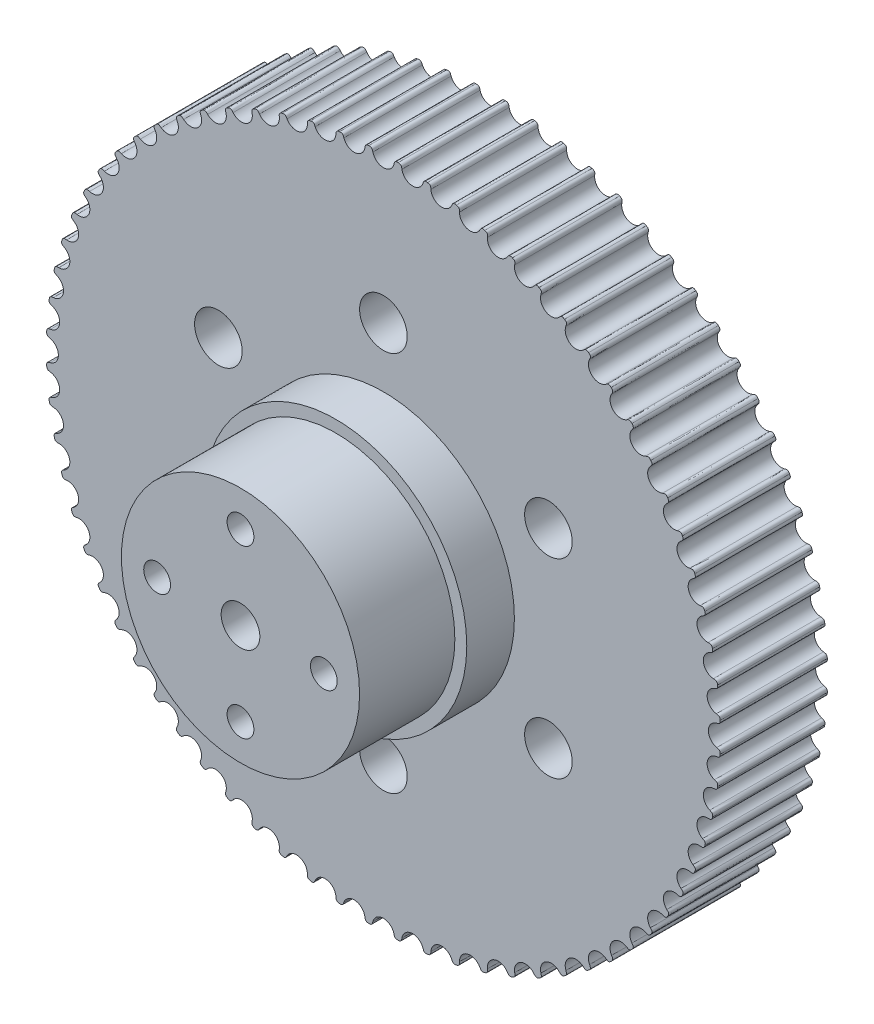
from build123d import *

# Parameters (mm, degrees)
EXTRUDE_2_DEPTH      = 18
SKETCH_23_R          = 22
EXTRUDE_5_DEPTH      = 8
SKETCH_24_R          = 20
EXTRUDE_6_DEPTH      = 16
SKETCH_25_R          = 3.25
SKETCH_25_R_2        = 2.25
CUT_EXTRUDE_16_DEPTH = 91.3315679
SKETCH_26_R          = 2.25
CUT_EXTRUDE_17_DEPTH = 91.3315679
SKETCH_27_R          = 4
CUT_EXTRUDE_18_DEPTH = 6
CUT_EXTRUDE_19_DEPTH = 12


# Read off the part's stored shape, not the designer's step: Бобышка-Вытянуть2
with BuildPart() as part:
    # Бобышка-Вытянуть2 outline → Бобышка-Вытянуть2 (new body)
    with BuildSketch(Plane.XY):
        with BuildLine():
            add(Edge.make_bspline(
                [(2.468857325, 56.546129342), (2.17643088, 56.560299637), (2.101180795, 56.529371891), (1.843370743, 56.341695548), (1.831638936, 56.156220412), (1.765942991, 55.959721279)],
                knots=[0, 0, 0, 0, 0.423843508, 0.523843508, 1, 1, 1, 1], degree=3))
            ThreePointArc((1.765942991, 55.959721279), (0, 54.58), (-1.765942991, 55.959721279))
            add(Edge.make_bspline(
                [(-2.468857325, 56.546129342), (-2.17643088, 56.560299637), (-2.101180795, 56.529371891), (-1.843370743, 56.341695548), (-1.831638936, 56.156220412), (-1.765942991, 55.959721279)],
                knots=[0, 0, 0, 0, 0.423843508, 0.523843508, 1, 1, 1, 1], degree=3))
            add(Edge.make_bspline(
                [(-2.468857325, 56.546129342), (-2.761406021, 56.534759071), (-2.833674226, 56.497390537), (-3.074146162, 56.287958732), (-3.069668103, 56.102166891), (-3.117988027, 55.900689718)],
                knots=[0, 0, 0, 0, 0.423843508, 0.523843508, 1, 1, 1, 1], degree=3))
            ThreePointArc((-3.117988027, 55.900689718), (-4.756960439, 54.372306622), (-6.636434117, 55.592865572))
            add(Edge.make_bspline(
                [(-7.38778248, 56.115779154), (-7.097703829, 56.155382171), (-7.020044562, 56.131130591), (-6.746858484, 55.96663804), (-6.719006097, 55.782891187), (-6.636434117, 55.592865572)],
                knots=[0, 0, 0, 0, 0.423843508, 0.523843508, 1, 1, 1, 1], degree=3))
            add(Edge.make_bspline(
                [(-7.38778248, 56.115779154), (-7.678226956, 56.078954852), (-7.746963276, 56.035429927), (-7.968266959, 55.805836563), (-7.947613114, 55.621142005), (-7.978189274, 55.416220155)],
                knots=[0, 0, 0, 0, 0.423843508, 0.523843508, 1, 1, 1, 1], degree=3))
            ThreePointArc((-7.978189274, 55.416220155), (-9.477717537, 53.750807159), (-11.456417972, 54.80291459))
            add(Edge.make_bspline(
                [(-12.250482149, 55.258354003), (-11.964958965, 55.323088339), (-11.885481551, 55.305697495), (-11.598998558, 55.165640623), (-11.555237564, 54.985020478), (-11.456417972, 54.80291459)],
                knots=[0, 0, 0, 0, 0.423843508, 0.523843508, 1, 1, 1, 1], degree=3))
            add(Edge.make_bspline(
                [(-12.250482149, 55.258354003), (-12.536611946, 55.196355925), (-12.601293257, 55.14700586), (-12.801744433, 54.898998282), (-12.765071991, 54.716806643), (-12.777671683, 54.509999694)],
                knots=[0, 0, 0, 0, 0.423843508, 0.523843508, 1, 1, 1, 1], degree=3))
            ThreePointArc((-12.777671683, 54.509999694), (-14.126343482, 52.720231599), (-16.189211569, 53.595880337))
            add(Edge.make_bspline(
                [(-17.019948252, 53.980379412), (-16.741153539, 54.0697524), (-16.660462849, 54.059354646), (-16.362863249, 53.944799371), (-16.303526697, 53.768680562), (-16.189211569, 53.595880337)],
                knots=[0, 0, 0, 0, 0.423843508, 0.523843508, 1, 1, 1, 1], degree=3))
            add(Edge.make_bspline(
                [(-17.019948252, 53.980379412), (-17.299585751, 53.8936794), (-17.359719788, 53.83887978), (-17.537792902, 53.574345474), (-17.485380962, 53.396043344), (-17.479908295, 53.188925222)],
                knots=[0, 0, 0, 0, 0.423843508, 0.523843508, 1, 1, 1, 1], degree=3))
            ThreePointArc((-17.479908295, 53.188925222), (-18.667459423, 51.288423242), (-20.79879549, 51.980949073))
            add(Edge.make_bspline(
                [(-21.659882272, 52.29158154), (-21.389937826, 52.404912997), (-21.308647964, 52.401587467), (-21.002196671, 52.313405623), (-20.927736146, 52.143128521), (-20.79879549, 51.980949073)],
                knots=[0, 0, 0, 0, 0.423843508, 0.523843508, 1, 1, 1, 1], degree=3))
            add(Edge.make_bspline(
                [(-21.659882272, 52.29158154), (-21.930899262, 52.180839434), (-21.986028369, 52.121007316), (-22.140368177, 51.841959549), (-22.072615626, 51.668903913), (-22.04911225, 51.463050913)],
                knots=[0, 0, 0, 0, 0.423843508, 0.523843508, 1, 1, 1, 1], degree=3))
            ThreePointArc((-22.04911225, 51.463050913), (-23.066504726, 49.466279016), (-25.250088019, 49.970411399))
            add(Edge.make_bspline(
                [(-26.134971509, 50.204813158), (-25.875931771, 50.341240563), (-25.794661402, 50.345012566), (-25.481690695, 50.28387527), (-25.392672887, 50.120735787), (-25.250088019, 49.970411399)],
                knots=[0, 0, 0, 0, 0.423843508, 0.523843508, 1, 1, 1, 1], degree=3))
            add(Edge.make_bspline(
                [(-26.134971509, 50.204813158), (-26.395305387, 50.070871772), (-26.445009999, 50.006462515), (-26.574441882, 49.715025008), (-26.491864357, 49.548532925), (-26.450509148, 49.345511712)],
                knots=[0, 0, 0, 0, 0.423843508, 0.523843508, 1, 1, 1, 1], degree=3))
            ThreePointArc((-26.450509148, 49.345511712), (-27.290000001, 47.267666539), (-29.509212132, 47.579568721))
            add(Edge.make_bspline(
                [(-30.411157832, 47.735955833), (-30.164994251, 47.894440891), (-30.084361892, 47.90528172), (-29.767253666, 47.871654265), (-29.664356055, 47.716893989), (-29.509212132, 47.579568721)],
                knots=[0, 0, 0, 0, 0.423843508, 0.523843508, 1, 1, 1, 1], degree=3))
            add(Edge.make_bspline(
                [(-30.411157832, 47.735955833), (-30.6588273, 47.579834542), (-30.702729135, 47.51133834), (-30.806268038, 47.209729108), (-30.709494004, 47.051067684), (-30.650601699, 46.852423372)],
                knots=[0, 0, 0, 0, 0.423843508, 0.523843508, 1, 1, 1, 1], degree=3))
            ThreePointArc((-30.650601699, 46.852423372), (-31.305801896, 44.709318577), (-33.543753322, 44.826616796))
            add(Edge.make_bspline(
                [(-34.455896882, 44.90379906), (-34.22448291, 45.083135605), (-34.145102222, 45.100962754), (-33.826269863, 45.095101065), (-33.710275562, 44.949897816), (-33.543753322, 44.826616796)],
                knots=[0, 0, 0, 0, 0.423843508, 0.523843508, 1, 1, 1, 1], degree=3))
            add(Edge.make_bspline(
                [(-34.455896882, 44.90379906), (-34.689017025, 44.726686041), (-34.726781963, 44.654624191), (-34.803639892, 44.345138664), (-34.693405859, 44.195515407), (-34.617424665, 44.002759799)],
                knots=[0, 0, 0, 0, 0.423843508, 0.523843508, 1, 1, 1, 1], degree=3))
            ThreePointArc((-34.617424665, 44.002759799), (-35.083347736, 41.810705705), (-37.323006295, 41.73250725))
            add(Edge.make_bspline(
                [(-38.238405751, 41.729897263), (-38.023502589, 41.928720435), (-37.945977707, 41.953398229), (-37.627847721, 41.975346916), (-37.499639517, 41.84080578), (-37.323006295, 41.73250725)],
                knots=[0, 0, 0, 0, 0.423843508, 0.523843508, 1, 1, 1, 1], degree=3))
            add(Edge.make_bspline(
                [(-38.238405751, 41.729897263), (-38.455202385, 41.533140454), (-38.486543012, 41.458061389), (-38.536135033, 41.143054938), (-38.413279947, 41.003608572), (-38.320788126, 40.818208654)],
                knots=[0, 0, 0, 0, 0.423843508, 0.523843508, 1, 1, 1, 1], degree=3))
            ThreePointArc((-38.320788126, 40.818208654), (-38.593888117, 38.593888117), (-40.818208654, 38.320788126))
            add(Edge.make_bspline(
                [(-41.729897263, 38.238405751), (-41.533140454, 38.455202385), (-41.458061389, 38.486543012), (-41.143054938, 38.536135033), (-41.003608572, 38.413279947), (-40.818208654, 38.320788126)],
                knots=[0, 0, 0, 0, 0.423843508, 0.523843508, 1, 1, 1, 1], degree=3))
            add(Edge.make_bspline(
                [(-41.729897263, 38.238405751), (-41.928720435, 38.023502589), (-41.953398229, 37.945977707), (-41.975346916, 37.627847721), (-41.84080578, 37.499639517), (-41.73250725, 37.323006295)],
                knots=[0, 0, 0, 0, 0.423843508, 0.523843508, 1, 1, 1, 1], degree=3))
            ThreePointArc((-41.73250725, 37.323006295), (-41.810705705, 35.083347736), (-44.002759799, 34.617424665))
            add(Edge.make_bspline(
                [(-44.90379906, 34.455896882), (-44.726686041, 34.689017025), (-44.654624191, 34.726781963), (-44.345138664, 34.803639892), (-44.195515407, 34.693405859), (-44.002759799, 34.617424665)],
                knots=[0, 0, 0, 0, 0.423843508, 0.523843508, 1, 1, 1, 1], degree=3))
            add(Edge.make_bspline(
                [(-44.90379906, 34.455896882), (-45.083135605, 34.22448291), (-45.100962754, 34.145102222), (-45.095101065, 33.826269863), (-44.949897816, 33.710275562), (-44.826616796, 33.543753322)],
                knots=[0, 0, 0, 0, 0.423843508, 0.523843508, 1, 1, 1, 1], degree=3))
            ThreePointArc((-44.826616796, 33.543753322), (-44.709318577, 31.305801896), (-46.852423372, 30.650601699))
            add(Edge.make_bspline(
                [(-47.735955833, 30.411157832), (-47.579834542, 30.6588273), (-47.51133834, 30.702729135), (-47.209729108, 30.806268038), (-47.051067684, 30.709494004), (-46.852423372, 30.650601699)],
                knots=[0, 0, 0, 0, 0.423843508, 0.523843508, 1, 1, 1, 1], degree=3))
            add(Edge.make_bspline(
                [(-47.735955833, 30.411157832), (-47.894440891, 30.164994251), (-47.90528172, 30.084361892), (-47.871654265, 29.767253666), (-47.716893989, 29.664356055), (-47.579568721, 29.509212132)],
                knots=[0, 0, 0, 0, 0.423843508, 0.523843508, 1, 1, 1, 1], degree=3))
            ThreePointArc((-47.579568721, 29.509212132), (-47.267666539, 27.290000001), (-49.345511712, 26.450509148))
            add(Edge.make_bspline(
                [(-50.204813158, 26.134971509), (-50.070871772, 26.395305387), (-50.006462515, 26.445009999), (-49.715025008, 26.574441882), (-49.548532925, 26.491864357), (-49.345511712, 26.450509148)],
                knots=[0, 0, 0, 0, 0.423843508, 0.523843508, 1, 1, 1, 1], degree=3))
            add(Edge.make_bspline(
                [(-50.204813158, 26.134971509), (-50.341240563, 25.875931771), (-50.345012566, 25.794661402), (-50.28387527, 25.481690695), (-50.120735787, 25.392672887), (-49.970411399, 25.250088019)],
                knots=[0, 0, 0, 0, 0.423843508, 0.523843508, 1, 1, 1, 1], degree=3))
            ThreePointArc((-49.970411399, 25.250088019), (-49.466279016, 23.066504726), (-51.463050913, 22.04911225))
            add(Edge.make_bspline(
                [(-52.29158154, 21.659882272), (-52.180839434, 21.930899262), (-52.121007316, 21.986028369), (-51.841959549, 22.140368177), (-51.668903913, 22.072615626), (-51.463050913, 22.04911225)],
                knots=[0, 0, 0, 0, 0.423843508, 0.523843508, 1, 1, 1, 1], degree=3))
            add(Edge.make_bspline(
                [(-52.29158154, 21.659882272), (-52.404912997, 21.389937826), (-52.401587467, 21.308647964), (-52.313405623, 21.002196671), (-52.143128521, 20.927736146), (-51.980949073, 20.79879549)],
                knots=[0, 0, 0, 0, 0.423843508, 0.523843508, 1, 1, 1, 1], degree=3))
            ThreePointArc((-51.980949073, 20.79879549), (-51.288423242, 18.667459423), (-53.188925222, 17.479908295))
            add(Edge.make_bspline(
                [(-53.980379412, 17.019948252), (-53.8936794, 17.299585751), (-53.83887978, 17.359719788), (-53.574345474, 17.537792902), (-53.396043344, 17.485380962), (-53.188925222, 17.479908295)],
                knots=[0, 0, 0, 0, 0.423843508, 0.523843508, 1, 1, 1, 1], degree=3))
            add(Edge.make_bspline(
                [(-53.980379412, 17.019948252), (-54.0697524, 16.741153539), (-54.059354646, 16.660462849), (-53.944799371, 16.362863249), (-53.768680562, 16.303526697), (-53.595880337, 16.189211569)],
                knots=[0, 0, 0, 0, 0.423843508, 0.523843508, 1, 1, 1, 1], degree=3))
            ThreePointArc((-53.595880337, 16.189211569), (-52.720231599, 14.126343482), (-54.509999694, 12.777671683))
            add(Edge.make_bspline(
                [(-55.258354003, 12.250482149), (-55.196355925, 12.536611946), (-55.14700586, 12.601293257), (-54.898998282, 12.801744433), (-54.716806643, 12.765071991), (-54.509999694, 12.777671683)],
                knots=[0, 0, 0, 0, 0.423843508, 0.523843508, 1, 1, 1, 1], degree=3))
            add(Edge.make_bspline(
                [(-55.258354003, 12.250482149), (-55.323088339, 11.964958965), (-55.305697495, 11.885481551), (-55.165640623, 11.598998558), (-54.985020478, 11.555237564), (-54.80291459, 11.456417972)],
                knots=[0, 0, 0, 0, 0.423843508, 0.523843508, 1, 1, 1, 1], degree=3))
            ThreePointArc((-54.80291459, 11.456417972), (-53.750807159, 9.477717537), (-55.416220155, 7.978189274))
            add(Edge.make_bspline(
                [(-56.115779154, 7.38778248), (-56.078954852, 7.678226956), (-56.035429927, 7.746963276), (-55.805836563, 7.968266959), (-55.621142005, 7.947613114), (-55.416220155, 7.978189274)],
                knots=[0, 0, 0, 0, 0.423843508, 0.523843508, 1, 1, 1, 1], degree=3))
            add(Edge.make_bspline(
                [(-56.115779154, 7.38778248), (-56.155382171, 7.097703829), (-56.131130591, 7.020044562), (-55.96663804, 6.746858484), (-55.782891187, 6.719006097), (-55.592865572, 6.636434117)],
                knots=[0, 0, 0, 0, 0.423843508, 0.523843508, 1, 1, 1, 1], degree=3))
            ThreePointArc((-55.592865572, 6.636434117), (-54.372306622, 4.756960439), (-55.900689718, 3.117988027))
            add(Edge.make_bspline(
                [(-56.546129342, 2.468857325), (-56.534759071, 2.761406021), (-56.497390537, 2.833674226), (-56.287958732, 3.074146162), (-56.102166891, 3.069668103), (-55.900689718, 3.117988027)],
                knots=[0, 0, 0, 0, 0.423843508, 0.523843508, 1, 1, 1, 1], degree=3))
            add(Edge.make_bspline(
                [(-56.546129342, 2.468857325), (-56.560299637, 2.17643088), (-56.529371891, 2.101180795), (-56.341695548, 1.843370743), (-56.156220412, 1.831638936), (-55.959721279, 1.765942991)],
                knots=[0, 0, 0, 0, 0.423843508, 0.523843508, 1, 1, 1, 1], degree=3))
            ThreePointArc((-55.959721279, 1.765942991), (-54.58, 0), (-55.959721279, -1.765942991))
            add(Edge.make_bspline(
                [(-56.546129342, -2.468857325), (-56.560299637, -2.17643088), (-56.529371891, -2.101180795), (-56.341695548, -1.843370743), (-56.156220412, -1.831638936), (-55.959721279, -1.765942991)],
                knots=[0, 0, 0, 0, 0.423843508, 0.523843508, 1, 1, 1, 1], degree=3))
            add(Edge.make_bspline(
                [(-56.546129342, -2.468857325), (-56.534759071, -2.761406021), (-56.497390537, -2.833674226), (-56.287958732, -3.074146162), (-56.102166891, -3.069668103), (-55.900689718, -3.117988027)],
                knots=[0, 0, 0, 0, 0.423843508, 0.523843508, 1, 1, 1, 1], degree=3))
            ThreePointArc((-55.900689718, -3.117988027), (-54.372306622, -4.756960439), (-55.592865572, -6.636434117))
            add(Edge.make_bspline(
                [(-56.115779154, -7.38778248), (-56.155382171, -7.097703829), (-56.131130591, -7.020044562), (-55.96663804, -6.746858484), (-55.782891187, -6.719006097), (-55.592865572, -6.636434117)],
                knots=[0, 0, 0, 0, 0.423843508, 0.523843508, 1, 1, 1, 1], degree=3))
            add(Edge.make_bspline(
                [(-56.115779154, -7.38778248), (-56.078954852, -7.678226956), (-56.035429927, -7.746963276), (-55.805836563, -7.968266959), (-55.621142005, -7.947613114), (-55.416220155, -7.978189274)],
                knots=[0, 0, 0, 0, 0.423843508, 0.523843508, 1, 1, 1, 1], degree=3))
            ThreePointArc((-55.416220155, -7.978189274), (-53.750807159, -9.477717537), (-54.80291459, -11.456417972))
            add(Edge.make_bspline(
                [(-55.258354003, -12.250482149), (-55.323088339, -11.964958965), (-55.305697495, -11.885481551), (-55.165640623, -11.598998558), (-54.985020478, -11.555237564), (-54.80291459, -11.456417972)],
                knots=[0, 0, 0, 0, 0.423843508, 0.523843508, 1, 1, 1, 1], degree=3))
            add(Edge.make_bspline(
                [(-55.258354003, -12.250482149), (-55.196355925, -12.536611946), (-55.14700586, -12.601293257), (-54.898998282, -12.801744433), (-54.716806643, -12.765071991), (-54.509999694, -12.777671683)],
                knots=[0, 0, 0, 0, 0.423843508, 0.523843508, 1, 1, 1, 1], degree=3))
            ThreePointArc((-54.509999694, -12.777671683), (-52.720231599, -14.126343482), (-53.595880337, -16.189211569))
            add(Edge.make_bspline(
                [(-53.980379412, -17.019948252), (-54.0697524, -16.741153539), (-54.059354646, -16.660462849), (-53.944799371, -16.362863249), (-53.768680562, -16.303526697), (-53.595880337, -16.189211569)],
                knots=[0, 0, 0, 0, 0.423843508, 0.523843508, 1, 1, 1, 1], degree=3))
            add(Edge.make_bspline(
                [(-53.980379412, -17.019948252), (-53.8936794, -17.299585751), (-53.83887978, -17.359719788), (-53.574345474, -17.537792902), (-53.396043344, -17.485380962), (-53.188925222, -17.479908295)],
                knots=[0, 0, 0, 0, 0.423843508, 0.523843508, 1, 1, 1, 1], degree=3))
            ThreePointArc((-53.188925222, -17.479908295), (-51.288423242, -18.667459423), (-51.980949073, -20.79879549))
            add(Edge.make_bspline(
                [(-52.29158154, -21.659882272), (-52.404912997, -21.389937826), (-52.401587467, -21.308647964), (-52.313405623, -21.002196671), (-52.143128521, -20.927736146), (-51.980949073, -20.79879549)],
                knots=[0, 0, 0, 0, 0.423843508, 0.523843508, 1, 1, 1, 1], degree=3))
            add(Edge.make_bspline(
                [(-52.29158154, -21.659882272), (-52.180839434, -21.930899262), (-52.121007316, -21.986028369), (-51.841959549, -22.140368177), (-51.668903913, -22.072615626), (-51.463050913, -22.04911225)],
                knots=[0, 0, 0, 0, 0.423843508, 0.523843508, 1, 1, 1, 1], degree=3))
            ThreePointArc((-51.463050913, -22.04911225), (-49.466279016, -23.066504726), (-49.970411399, -25.250088019))
            add(Edge.make_bspline(
                [(-50.204813158, -26.134971509), (-50.341240563, -25.875931771), (-50.345012566, -25.794661402), (-50.28387527, -25.481690695), (-50.120735787, -25.392672887), (-49.970411399, -25.250088019)],
                knots=[0, 0, 0, 0, 0.423843508, 0.523843508, 1, 1, 1, 1], degree=3))
            add(Edge.make_bspline(
                [(-50.204813158, -26.134971509), (-50.070871772, -26.395305387), (-50.006462515, -26.445009999), (-49.715025008, -26.574441882), (-49.548532925, -26.491864357), (-49.345511712, -26.450509148)],
                knots=[0, 0, 0, 0, 0.423843508, 0.523843508, 1, 1, 1, 1], degree=3))
            ThreePointArc((-49.345511712, -26.450509148), (-47.267666539, -27.290000001), (-47.579568721, -29.509212132))
            add(Edge.make_bspline(
                [(-47.735955833, -30.411157832), (-47.894440891, -30.164994251), (-47.90528172, -30.084361892), (-47.871654265, -29.767253666), (-47.716893989, -29.664356055), (-47.579568721, -29.509212132)],
                knots=[0, 0, 0, 0, 0.423843508, 0.523843508, 1, 1, 1, 1], degree=3))
            add(Edge.make_bspline(
                [(-47.735955833, -30.411157832), (-47.579834542, -30.6588273), (-47.51133834, -30.702729135), (-47.209729108, -30.806268038), (-47.051067684, -30.709494004), (-46.852423372, -30.650601699)],
                knots=[0, 0, 0, 0, 0.423843508, 0.523843508, 1, 1, 1, 1], degree=3))
            ThreePointArc((-46.852423372, -30.650601699), (-44.709318577, -31.305801896), (-44.826616796, -33.543753322))
            add(Edge.make_bspline(
                [(-44.90379906, -34.455896882), (-45.083135605, -34.22448291), (-45.100962754, -34.145102222), (-45.095101065, -33.826269863), (-44.949897816, -33.710275562), (-44.826616796, -33.543753322)],
                knots=[0, 0, 0, 0, 0.423843508, 0.523843508, 1, 1, 1, 1], degree=3))
            add(Edge.make_bspline(
                [(-44.90379906, -34.455896882), (-44.726686041, -34.689017025), (-44.654624191, -34.726781963), (-44.345138664, -34.803639892), (-44.195515407, -34.693405859), (-44.002759799, -34.617424665)],
                knots=[0, 0, 0, 0, 0.423843508, 0.523843508, 1, 1, 1, 1], degree=3))
            ThreePointArc((-44.002759799, -34.617424665), (-41.810705705, -35.083347736), (-41.73250725, -37.323006295))
            add(Edge.make_bspline(
                [(-41.729897263, -38.238405751), (-41.928720435, -38.023502589), (-41.953398229, -37.945977707), (-41.975346916, -37.627847721), (-41.84080578, -37.499639517), (-41.73250725, -37.323006295)],
                knots=[0, 0, 0, 0, 0.423843508, 0.523843508, 1, 1, 1, 1], degree=3))
            add(Edge.make_bspline(
                [(-41.729897263, -38.238405751), (-41.533140454, -38.455202385), (-41.458061389, -38.486543012), (-41.143054938, -38.536135033), (-41.003608572, -38.413279947), (-40.818208654, -38.320788126)],
                knots=[0, 0, 0, 0, 0.423843508, 0.523843508, 1, 1, 1, 1], degree=3))
            ThreePointArc((-40.818208654, -38.320788126), (-38.593888117, -38.593888117), (-38.320788126, -40.818208654))
            add(Edge.make_bspline(
                [(-38.238405751, -41.729897263), (-38.455202385, -41.533140454), (-38.486543012, -41.458061389), (-38.536135033, -41.143054938), (-38.413279947, -41.003608572), (-38.320788126, -40.818208654)],
                knots=[0, 0, 0, 0, 0.423843508, 0.523843508, 1, 1, 1, 1], degree=3))
            add(Edge.make_bspline(
                [(-38.238405751, -41.729897263), (-38.023502589, -41.928720435), (-37.945977707, -41.953398229), (-37.627847721, -41.975346916), (-37.499639517, -41.84080578), (-37.323006295, -41.73250725)],
                knots=[0, 0, 0, 0, 0.423843508, 0.523843508, 1, 1, 1, 1], degree=3))
            ThreePointArc((-37.323006295, -41.73250725), (-35.083347736, -41.810705705), (-34.617424665, -44.002759799))
            add(Edge.make_bspline(
                [(-34.455896882, -44.90379906), (-34.689017025, -44.726686041), (-34.726781963, -44.654624191), (-34.803639892, -44.345138664), (-34.693405859, -44.195515407), (-34.617424665, -44.002759799)],
                knots=[0, 0, 0, 0, 0.423843508, 0.523843508, 1, 1, 1, 1], degree=3))
            add(Edge.make_bspline(
                [(-34.455896882, -44.90379906), (-34.22448291, -45.083135605), (-34.145102222, -45.100962754), (-33.826269863, -45.095101065), (-33.710275562, -44.949897816), (-33.543753322, -44.826616796)],
                knots=[0, 0, 0, 0, 0.423843508, 0.523843508, 1, 1, 1, 1], degree=3))
            ThreePointArc((-33.543753322, -44.826616796), (-31.305801896, -44.709318577), (-30.650601699, -46.852423372))
            add(Edge.make_bspline(
                [(-30.411157832, -47.735955833), (-30.6588273, -47.579834542), (-30.702729135, -47.51133834), (-30.806268038, -47.209729108), (-30.709494004, -47.051067684), (-30.650601699, -46.852423372)],
                knots=[0, 0, 0, 0, 0.423843508, 0.523843508, 1, 1, 1, 1], degree=3))
            add(Edge.make_bspline(
                [(-30.411157832, -47.735955833), (-30.164994251, -47.894440891), (-30.084361892, -47.90528172), (-29.767253666, -47.871654265), (-29.664356055, -47.716893989), (-29.509212132, -47.579568721)],
                knots=[0, 0, 0, 0, 0.423843508, 0.523843508, 1, 1, 1, 1], degree=3))
            ThreePointArc((-29.509212132, -47.579568721), (-27.290000001, -47.267666539), (-26.450509148, -49.345511712))
            add(Edge.make_bspline(
                [(-26.134971509, -50.204813158), (-26.395305387, -50.070871772), (-26.445009999, -50.006462515), (-26.574441882, -49.715025008), (-26.491864357, -49.548532925), (-26.450509148, -49.345511712)],
                knots=[0, 0, 0, 0, 0.423843508, 0.523843508, 1, 1, 1, 1], degree=3))
            add(Edge.make_bspline(
                [(-26.134971509, -50.204813158), (-25.875931771, -50.341240563), (-25.794661402, -50.345012566), (-25.481690695, -50.28387527), (-25.392672887, -50.120735787), (-25.250088019, -49.970411399)],
                knots=[0, 0, 0, 0, 0.423843508, 0.523843508, 1, 1, 1, 1], degree=3))
            ThreePointArc((-25.250088019, -49.970411399), (-23.066504726, -49.466279016), (-22.04911225, -51.463050913))
            add(Edge.make_bspline(
                [(-21.659882272, -52.29158154), (-21.930899262, -52.180839434), (-21.986028369, -52.121007316), (-22.140368177, -51.841959549), (-22.072615626, -51.668903913), (-22.04911225, -51.463050913)],
                knots=[0, 0, 0, 0, 0.423843508, 0.523843508, 1, 1, 1, 1], degree=3))
            add(Edge.make_bspline(
                [(-21.659882272, -52.29158154), (-21.389937826, -52.404912997), (-21.308647964, -52.401587467), (-21.002196671, -52.313405623), (-20.927736146, -52.143128521), (-20.79879549, -51.980949073)],
                knots=[0, 0, 0, 0, 0.423843508, 0.523843508, 1, 1, 1, 1], degree=3))
            ThreePointArc((-20.79879549, -51.980949073), (-18.667459423, -51.288423242), (-17.479908295, -53.188925222))
            add(Edge.make_bspline(
                [(-17.019948252, -53.980379412), (-17.299585751, -53.8936794), (-17.359719788, -53.83887978), (-17.537792902, -53.574345474), (-17.485380962, -53.396043344), (-17.479908295, -53.188925222)],
                knots=[0, 0, 0, 0, 0.423843508, 0.523843508, 1, 1, 1, 1], degree=3))
            add(Edge.make_bspline(
                [(-17.019948252, -53.980379412), (-16.741153539, -54.0697524), (-16.660462849, -54.059354646), (-16.362863249, -53.944799371), (-16.303526697, -53.768680562), (-16.189211569, -53.595880337)],
                knots=[0, 0, 0, 0, 0.423843508, 0.523843508, 1, 1, 1, 1], degree=3))
            ThreePointArc((-16.189211569, -53.595880337), (-14.126343482, -52.720231599), (-12.777671683, -54.509999694))
            add(Edge.make_bspline(
                [(-12.250482149, -55.258354003), (-12.536611946, -55.196355925), (-12.601293257, -55.14700586), (-12.801744433, -54.898998282), (-12.765071991, -54.716806643), (-12.777671683, -54.509999694)],
                knots=[0, 0, 0, 0, 0.423843508, 0.523843508, 1, 1, 1, 1], degree=3))
            add(Edge.make_bspline(
                [(-12.250482149, -55.258354003), (-11.964958965, -55.323088339), (-11.885481551, -55.305697495), (-11.598998558, -55.165640623), (-11.555237564, -54.985020478), (-11.456417972, -54.80291459)],
                knots=[0, 0, 0, 0, 0.423843508, 0.523843508, 1, 1, 1, 1], degree=3))
            ThreePointArc((-11.456417972, -54.80291459), (-9.477717537, -53.750807159), (-7.978189274, -55.416220155))
            add(Edge.make_bspline(
                [(-7.38778248, -56.115779154), (-7.678226956, -56.078954852), (-7.746963276, -56.035429927), (-7.968266959, -55.805836563), (-7.947613114, -55.621142005), (-7.978189274, -55.416220155)],
                knots=[0, 0, 0, 0, 0.423843508, 0.523843508, 1, 1, 1, 1], degree=3))
            add(Edge.make_bspline(
                [(-7.38778248, -56.115779154), (-7.097703829, -56.155382171), (-7.020044562, -56.131130591), (-6.746858484, -55.96663804), (-6.719006097, -55.782891187), (-6.636434117, -55.592865572)],
                knots=[0, 0, 0, 0, 0.423843508, 0.523843508, 1, 1, 1, 1], degree=3))
            ThreePointArc((-6.636434117, -55.592865572), (-4.756960439, -54.372306622), (-3.117988027, -55.900689718))
            add(Edge.make_bspline(
                [(-2.468857325, -56.546129342), (-2.761406021, -56.534759071), (-2.833674226, -56.497390537), (-3.074146162, -56.287958732), (-3.069668103, -56.102166891), (-3.117988027, -55.900689718)],
                knots=[0, 0, 0, 0, 0.423843508, 0.523843508, 1, 1, 1, 1], degree=3))
            add(Edge.make_bspline(
                [(-2.468857325, -56.546129342), (-2.17643088, -56.560299637), (-2.101180795, -56.529371891), (-1.843370743, -56.341695548), (-1.831638936, -56.156220412), (-1.765942991, -55.959721279)],
                knots=[0, 0, 0, 0, 0.423843508, 0.523843508, 1, 1, 1, 1], degree=3))
            ThreePointArc((-1.765942991, -55.959721279), (0, -54.58), (1.765942991, -55.959721279))
            add(Edge.make_bspline(
                [(2.468857325, -56.546129342), (2.17643088, -56.560299637), (2.101180795, -56.529371891), (1.843370743, -56.341695548), (1.831638936, -56.156220412), (1.765942991, -55.959721279)],
                knots=[0, 0, 0, 0, 0.423843508, 0.523843508, 1, 1, 1, 1], degree=3))
            add(Edge.make_bspline(
                [(2.468857325, -56.546129342), (2.761406021, -56.534759071), (2.833674226, -56.497390537), (3.074146162, -56.287958732), (3.069668103, -56.102166891), (3.117988027, -55.900689718)],
                knots=[0, 0, 0, 0, 0.423843508, 0.523843508, 1, 1, 1, 1], degree=3))
            ThreePointArc((3.117988027, -55.900689718), (4.756960439, -54.372306622), (6.636434117, -55.592865572))
            add(Edge.make_bspline(
                [(7.38778248, -56.115779154), (7.097703829, -56.155382171), (7.020044562, -56.131130591), (6.746858484, -55.96663804), (6.719006097, -55.782891187), (6.636434117, -55.592865572)],
                knots=[0, 0, 0, 0, 0.423843508, 0.523843508, 1, 1, 1, 1], degree=3))
            add(Edge.make_bspline(
                [(7.38778248, -56.115779154), (7.678226956, -56.078954852), (7.746963276, -56.035429927), (7.968266959, -55.805836563), (7.947613114, -55.621142005), (7.978189274, -55.416220155)],
                knots=[0, 0, 0, 0, 0.423843508, 0.523843508, 1, 1, 1, 1], degree=3))
            ThreePointArc((7.978189274, -55.416220155), (9.477717537, -53.750807159), (11.456417972, -54.80291459))
            add(Edge.make_bspline(
                [(12.250482149, -55.258354003), (11.964958965, -55.323088339), (11.885481551, -55.305697495), (11.598998558, -55.165640623), (11.555237564, -54.985020478), (11.456417972, -54.80291459)],
                knots=[0, 0, 0, 0, 0.423843508, 0.523843508, 1, 1, 1, 1], degree=3))
            add(Edge.make_bspline(
                [(12.250482149, -55.258354003), (12.536611946, -55.196355925), (12.601293257, -55.14700586), (12.801744433, -54.898998282), (12.765071991, -54.716806643), (12.777671683, -54.509999694)],
                knots=[0, 0, 0, 0, 0.423843508, 0.523843508, 1, 1, 1, 1], degree=3))
            ThreePointArc((12.777671683, -54.509999694), (14.126343482, -52.720231599), (16.189211569, -53.595880337))
            add(Edge.make_bspline(
                [(17.019948252, -53.980379412), (16.741153539, -54.0697524), (16.660462849, -54.059354646), (16.362863249, -53.944799371), (16.303526697, -53.768680562), (16.189211569, -53.595880337)],
                knots=[0, 0, 0, 0, 0.423843508, 0.523843508, 1, 1, 1, 1], degree=3))
            add(Edge.make_bspline(
                [(17.019948252, -53.980379412), (17.299585751, -53.8936794), (17.359719788, -53.83887978), (17.537792902, -53.574345474), (17.485380962, -53.396043344), (17.479908295, -53.188925222)],
                knots=[0, 0, 0, 0, 0.423843508, 0.523843508, 1, 1, 1, 1], degree=3))
            ThreePointArc((17.479908295, -53.188925222), (18.667459423, -51.288423242), (20.79879549, -51.980949073))
            add(Edge.make_bspline(
                [(21.659882272, -52.29158154), (21.389937826, -52.404912997), (21.308647964, -52.401587467), (21.002196671, -52.313405623), (20.927736146, -52.143128521), (20.79879549, -51.980949073)],
                knots=[0, 0, 0, 0, 0.423843508, 0.523843508, 1, 1, 1, 1], degree=3))
            add(Edge.make_bspline(
                [(21.659882272, -52.29158154), (21.930899262, -52.180839434), (21.986028369, -52.121007316), (22.140368177, -51.841959549), (22.072615626, -51.668903913), (22.04911225, -51.463050913)],
                knots=[0, 0, 0, 0, 0.423843508, 0.523843508, 1, 1, 1, 1], degree=3))
            ThreePointArc((22.04911225, -51.463050913), (23.066504726, -49.466279016), (25.250088019, -49.970411399))
            add(Edge.make_bspline(
                [(26.134971509, -50.204813158), (25.875931771, -50.341240563), (25.794661402, -50.345012566), (25.481690695, -50.28387527), (25.392672887, -50.120735787), (25.250088019, -49.970411399)],
                knots=[0, 0, 0, 0, 0.423843508, 0.523843508, 1, 1, 1, 1], degree=3))
            add(Edge.make_bspline(
                [(26.134971509, -50.204813158), (26.395305387, -50.070871772), (26.445009999, -50.006462515), (26.574441882, -49.715025008), (26.491864357, -49.548532925), (26.450509148, -49.345511712)],
                knots=[0, 0, 0, 0, 0.423843508, 0.523843508, 1, 1, 1, 1], degree=3))
            ThreePointArc((26.450509148, -49.345511712), (27.290000001, -47.267666539), (29.509212132, -47.579568721))
            add(Edge.make_bspline(
                [(30.411157832, -47.735955833), (30.164994251, -47.894440891), (30.084361892, -47.90528172), (29.767253666, -47.871654265), (29.664356055, -47.716893989), (29.509212132, -47.579568721)],
                knots=[0, 0, 0, 0, 0.423843508, 0.523843508, 1, 1, 1, 1], degree=3))
            add(Edge.make_bspline(
                [(30.411157832, -47.735955833), (30.6588273, -47.579834542), (30.702729135, -47.51133834), (30.806268038, -47.209729108), (30.709494004, -47.051067684), (30.650601699, -46.852423372)],
                knots=[0, 0, 0, 0, 0.423843508, 0.523843508, 1, 1, 1, 1], degree=3))
            ThreePointArc((30.650601699, -46.852423372), (31.305801896, -44.709318577), (33.543753322, -44.826616796))
            add(Edge.make_bspline(
                [(34.455896882, -44.90379906), (34.22448291, -45.083135605), (34.145102222, -45.100962754), (33.826269863, -45.095101065), (33.710275562, -44.949897816), (33.543753322, -44.826616796)],
                knots=[0, 0, 0, 0, 0.423843508, 0.523843508, 1, 1, 1, 1], degree=3))
            add(Edge.make_bspline(
                [(34.455896882, -44.90379906), (34.689017025, -44.726686041), (34.726781963, -44.654624191), (34.803639892, -44.345138664), (34.693405859, -44.195515407), (34.617424665, -44.002759799)],
                knots=[0, 0, 0, 0, 0.423843508, 0.523843508, 1, 1, 1, 1], degree=3))
            ThreePointArc((34.617424665, -44.002759799), (35.083347736, -41.810705705), (37.323006295, -41.73250725))
            add(Edge.make_bspline(
                [(38.238405751, -41.729897263), (38.023502589, -41.928720435), (37.945977707, -41.953398229), (37.627847721, -41.975346916), (37.499639517, -41.84080578), (37.323006295, -41.73250725)],
                knots=[0, 0, 0, 0, 0.423843508, 0.523843508, 1, 1, 1, 1], degree=3))
            add(Edge.make_bspline(
                [(38.238405751, -41.729897263), (38.455202385, -41.533140454), (38.486543012, -41.458061389), (38.536135033, -41.143054938), (38.413279947, -41.003608572), (38.320788126, -40.818208654)],
                knots=[0, 0, 0, 0, 0.423843508, 0.523843508, 1, 1, 1, 1], degree=3))
            ThreePointArc((38.320788126, -40.818208654), (38.593888117, -38.593888117), (40.818208654, -38.320788126))
            add(Edge.make_bspline(
                [(41.729897263, -38.238405751), (41.533140454, -38.455202385), (41.458061389, -38.486543012), (41.143054938, -38.536135033), (41.003608572, -38.413279947), (40.818208654, -38.320788126)],
                knots=[0, 0, 0, 0, 0.423843508, 0.523843508, 1, 1, 1, 1], degree=3))
            add(Edge.make_bspline(
                [(41.729897263, -38.238405751), (41.928720435, -38.023502589), (41.953398229, -37.945977707), (41.975346916, -37.627847721), (41.84080578, -37.499639517), (41.73250725, -37.323006295)],
                knots=[0, 0, 0, 0, 0.423843508, 0.523843508, 1, 1, 1, 1], degree=3))
            ThreePointArc((41.73250725, -37.323006295), (41.810705705, -35.083347736), (44.002759799, -34.617424665))
            add(Edge.make_bspline(
                [(44.90379906, -34.455896882), (44.726686041, -34.689017025), (44.654624191, -34.726781963), (44.345138664, -34.803639892), (44.195515407, -34.693405859), (44.002759799, -34.617424665)],
                knots=[0, 0, 0, 0, 0.423843508, 0.523843508, 1, 1, 1, 1], degree=3))
            add(Edge.make_bspline(
                [(44.90379906, -34.455896882), (45.083135605, -34.22448291), (45.100962754, -34.145102222), (45.095101065, -33.826269863), (44.949897816, -33.710275562), (44.826616796, -33.543753322)],
                knots=[0, 0, 0, 0, 0.423843508, 0.523843508, 1, 1, 1, 1], degree=3))
            ThreePointArc((44.826616796, -33.543753322), (44.709318577, -31.305801896), (46.852423372, -30.650601699))
            add(Edge.make_bspline(
                [(47.735955833, -30.411157832), (47.579834542, -30.6588273), (47.51133834, -30.702729135), (47.209729108, -30.806268038), (47.051067684, -30.709494004), (46.852423372, -30.650601699)],
                knots=[0, 0, 0, 0, 0.423843508, 0.523843508, 1, 1, 1, 1], degree=3))
            add(Edge.make_bspline(
                [(47.735955833, -30.411157832), (47.894440891, -30.164994251), (47.90528172, -30.084361892), (47.871654265, -29.767253666), (47.716893989, -29.664356055), (47.579568721, -29.509212132)],
                knots=[0, 0, 0, 0, 0.423843508, 0.523843508, 1, 1, 1, 1], degree=3))
            ThreePointArc((47.579568721, -29.509212132), (47.267666539, -27.290000001), (49.345511712, -26.450509148))
            add(Edge.make_bspline(
                [(50.204813158, -26.134971509), (50.070871772, -26.395305387), (50.006462515, -26.445009999), (49.715025008, -26.574441882), (49.548532925, -26.491864357), (49.345511712, -26.450509148)],
                knots=[0, 0, 0, 0, 0.423843508, 0.523843508, 1, 1, 1, 1], degree=3))
            add(Edge.make_bspline(
                [(50.204813158, -26.134971509), (50.341240563, -25.875931771), (50.345012566, -25.794661402), (50.28387527, -25.481690695), (50.120735787, -25.392672887), (49.970411399, -25.250088019)],
                knots=[0, 0, 0, 0, 0.423843508, 0.523843508, 1, 1, 1, 1], degree=3))
            ThreePointArc((49.970411399, -25.250088019), (49.466279016, -23.066504726), (51.463050913, -22.04911225))
            add(Edge.make_bspline(
                [(52.29158154, -21.659882272), (52.180839434, -21.930899262), (52.121007316, -21.986028369), (51.841959549, -22.140368177), (51.668903913, -22.072615626), (51.463050913, -22.04911225)],
                knots=[0, 0, 0, 0, 0.423843508, 0.523843508, 1, 1, 1, 1], degree=3))
            add(Edge.make_bspline(
                [(52.29158154, -21.659882272), (52.404912997, -21.389937826), (52.401587467, -21.308647964), (52.313405623, -21.002196671), (52.143128521, -20.927736146), (51.980949073, -20.79879549)],
                knots=[0, 0, 0, 0, 0.423843508, 0.523843508, 1, 1, 1, 1], degree=3))
            ThreePointArc((51.980949073, -20.79879549), (51.288423242, -18.667459423), (53.188925222, -17.479908295))
            add(Edge.make_bspline(
                [(53.980379412, -17.019948252), (53.8936794, -17.299585751), (53.83887978, -17.359719788), (53.574345474, -17.537792902), (53.396043344, -17.485380962), (53.188925222, -17.479908295)],
                knots=[0, 0, 0, 0, 0.423843508, 0.523843508, 1, 1, 1, 1], degree=3))
            add(Edge.make_bspline(
                [(53.980379412, -17.019948252), (54.0697524, -16.741153539), (54.059354646, -16.660462849), (53.944799371, -16.362863249), (53.768680562, -16.303526697), (53.595880337, -16.189211569)],
                knots=[0, 0, 0, 0, 0.423843508, 0.523843508, 1, 1, 1, 1], degree=3))
            ThreePointArc((53.595880337, -16.189211569), (52.720231599, -14.126343482), (54.509999694, -12.777671683))
            add(Edge.make_bspline(
                [(55.258354003, -12.250482149), (55.196355925, -12.536611946), (55.14700586, -12.601293257), (54.898998282, -12.801744433), (54.716806643, -12.765071991), (54.509999694, -12.777671683)],
                knots=[0, 0, 0, 0, 0.423843508, 0.523843508, 1, 1, 1, 1], degree=3))
            add(Edge.make_bspline(
                [(55.258354003, -12.250482149), (55.323088339, -11.964958965), (55.305697495, -11.885481551), (55.165640623, -11.598998558), (54.985020478, -11.555237564), (54.80291459, -11.456417972)],
                knots=[0, 0, 0, 0, 0.423843508, 0.523843508, 1, 1, 1, 1], degree=3))
            ThreePointArc((54.80291459, -11.456417972), (53.750807159, -9.477717537), (55.416220155, -7.978189274))
            add(Edge.make_bspline(
                [(56.115779154, -7.38778248), (56.078954852, -7.678226956), (56.035429927, -7.746963276), (55.805836563, -7.968266959), (55.621142005, -7.947613114), (55.416220155, -7.978189274)],
                knots=[0, 0, 0, 0, 0.423843508, 0.523843508, 1, 1, 1, 1], degree=3))
            add(Edge.make_bspline(
                [(56.115779154, -7.38778248), (56.155382171, -7.097703829), (56.131130591, -7.020044562), (55.96663804, -6.746858484), (55.782891187, -6.719006097), (55.592865572, -6.636434117)],
                knots=[0, 0, 0, 0, 0.423843508, 0.523843508, 1, 1, 1, 1], degree=3))
            ThreePointArc((55.592865572, -6.636434117), (54.372306622, -4.756960439), (55.900689718, -3.117988027))
            add(Edge.make_bspline(
                [(56.546129342, -2.468857325), (56.534759071, -2.761406021), (56.497390537, -2.833674226), (56.287958732, -3.074146162), (56.102166891, -3.069668103), (55.900689718, -3.117988027)],
                knots=[0, 0, 0, 0, 0.423843508, 0.523843508, 1, 1, 1, 1], degree=3))
            add(Edge.make_bspline(
                [(56.546129342, -2.468857325), (56.560299637, -2.17643088), (56.529371891, -2.101180795), (56.341695548, -1.843370743), (56.156220412, -1.831638936), (55.959721279, -1.765942991)],
                knots=[0, 0, 0, 0, 0.423843508, 0.523843508, 1, 1, 1, 1], degree=3))
            ThreePointArc((55.959721279, -1.765942991), (54.58, 0), (55.959721279, 1.765942991))
            add(Edge.make_bspline(
                [(56.546129342, 2.468857325), (56.560299637, 2.17643088), (56.529371891, 2.101180795), (56.341695548, 1.843370743), (56.156220412, 1.831638936), (55.959721279, 1.765942991)],
                knots=[0, 0, 0, 0, 0.423843508, 0.523843508, 1, 1, 1, 1], degree=3))
            add(Edge.make_bspline(
                [(56.546129342, 2.468857325), (56.534759071, 2.761406021), (56.497390537, 2.833674226), (56.287958732, 3.074146162), (56.102166891, 3.069668103), (55.900689718, 3.117988027)],
                knots=[0, 0, 0, 0, 0.423843508, 0.523843508, 1, 1, 1, 1], degree=3))
            ThreePointArc((55.900689718, 3.117988027), (54.372306622, 4.756960439), (55.592865572, 6.636434117))
            add(Edge.make_bspline(
                [(56.115779154, 7.38778248), (56.155382171, 7.097703829), (56.131130591, 7.020044562), (55.96663804, 6.746858484), (55.782891187, 6.719006097), (55.592865572, 6.636434117)],
                knots=[0, 0, 0, 0, 0.423843508, 0.523843508, 1, 1, 1, 1], degree=3))
            add(Edge.make_bspline(
                [(56.115779154, 7.38778248), (56.078954852, 7.678226956), (56.035429927, 7.746963276), (55.805836563, 7.968266959), (55.621142005, 7.947613114), (55.416220155, 7.978189274)],
                knots=[0, 0, 0, 0, 0.423843508, 0.523843508, 1, 1, 1, 1], degree=3))
            ThreePointArc((55.416220155, 7.978189274), (53.750807159, 9.477717537), (54.80291459, 11.456417972))
            add(Edge.make_bspline(
                [(55.258354003, 12.250482149), (55.323088339, 11.964958965), (55.305697495, 11.885481551), (55.165640623, 11.598998558), (54.985020478, 11.555237564), (54.80291459, 11.456417972)],
                knots=[0, 0, 0, 0, 0.423843508, 0.523843508, 1, 1, 1, 1], degree=3))
            add(Edge.make_bspline(
                [(55.258354003, 12.250482149), (55.196355925, 12.536611946), (55.14700586, 12.601293257), (54.898998282, 12.801744433), (54.716806643, 12.765071991), (54.509999694, 12.777671683)],
                knots=[0, 0, 0, 0, 0.423843508, 0.523843508, 1, 1, 1, 1], degree=3))
            ThreePointArc((54.509999694, 12.777671683), (52.720231599, 14.126343482), (53.595880337, 16.189211569))
            add(Edge.make_bspline(
                [(53.980379412, 17.019948252), (54.0697524, 16.741153539), (54.059354646, 16.660462849), (53.944799371, 16.362863249), (53.768680562, 16.303526697), (53.595880337, 16.189211569)],
                knots=[0, 0, 0, 0, 0.423843508, 0.523843508, 1, 1, 1, 1], degree=3))
            add(Edge.make_bspline(
                [(53.980379412, 17.019948252), (53.8936794, 17.299585751), (53.83887978, 17.359719788), (53.574345474, 17.537792902), (53.396043344, 17.485380962), (53.188925222, 17.479908295)],
                knots=[0, 0, 0, 0, 0.423843508, 0.523843508, 1, 1, 1, 1], degree=3))
            ThreePointArc((53.188925222, 17.479908295), (51.288423242, 18.667459423), (51.980949073, 20.79879549))
            add(Edge.make_bspline(
                [(52.29158154, 21.659882272), (52.404912997, 21.389937826), (52.401587467, 21.308647964), (52.313405623, 21.002196671), (52.143128521, 20.927736146), (51.980949073, 20.79879549)],
                knots=[0, 0, 0, 0, 0.423843508, 0.523843508, 1, 1, 1, 1], degree=3))
            add(Edge.make_bspline(
                [(52.29158154, 21.659882272), (52.180839434, 21.930899262), (52.121007316, 21.986028369), (51.841959549, 22.140368177), (51.668903913, 22.072615626), (51.463050913, 22.04911225)],
                knots=[0, 0, 0, 0, 0.423843508, 0.523843508, 1, 1, 1, 1], degree=3))
            ThreePointArc((51.463050913, 22.04911225), (49.466279016, 23.066504726), (49.970411399, 25.250088019))
            add(Edge.make_bspline(
                [(50.204813158, 26.134971509), (50.341240563, 25.875931771), (50.345012566, 25.794661402), (50.28387527, 25.481690695), (50.120735787, 25.392672887), (49.970411399, 25.250088019)],
                knots=[0, 0, 0, 0, 0.423843508, 0.523843508, 1, 1, 1, 1], degree=3))
            add(Edge.make_bspline(
                [(50.204813158, 26.134971509), (50.070871772, 26.395305387), (50.006462515, 26.445009999), (49.715025008, 26.574441882), (49.548532925, 26.491864357), (49.345511712, 26.450509148)],
                knots=[0, 0, 0, 0, 0.423843508, 0.523843508, 1, 1, 1, 1], degree=3))
            ThreePointArc((49.345511712, 26.450509148), (47.267666539, 27.290000001), (47.579568721, 29.509212132))
            add(Edge.make_bspline(
                [(47.735955833, 30.411157832), (47.894440891, 30.164994251), (47.90528172, 30.084361892), (47.871654265, 29.767253666), (47.716893989, 29.664356055), (47.579568721, 29.509212132)],
                knots=[0, 0, 0, 0, 0.423843508, 0.523843508, 1, 1, 1, 1], degree=3))
            add(Edge.make_bspline(
                [(47.735955833, 30.411157832), (47.579834542, 30.6588273), (47.51133834, 30.702729135), (47.209729108, 30.806268038), (47.051067684, 30.709494004), (46.852423372, 30.650601699)],
                knots=[0, 0, 0, 0, 0.423843508, 0.523843508, 1, 1, 1, 1], degree=3))
            ThreePointArc((46.852423372, 30.650601699), (44.709318577, 31.305801896), (44.826616796, 33.543753322))
            add(Edge.make_bspline(
                [(44.90379906, 34.455896882), (45.083135605, 34.22448291), (45.100962754, 34.145102222), (45.095101065, 33.826269863), (44.949897816, 33.710275562), (44.826616796, 33.543753322)],
                knots=[0, 0, 0, 0, 0.423843508, 0.523843508, 1, 1, 1, 1], degree=3))
            add(Edge.make_bspline(
                [(44.90379906, 34.455896882), (44.726686041, 34.689017025), (44.654624191, 34.726781963), (44.345138664, 34.803639892), (44.195515407, 34.693405859), (44.002759799, 34.617424665)],
                knots=[0, 0, 0, 0, 0.423843508, 0.523843508, 1, 1, 1, 1], degree=3))
            ThreePointArc((44.002759799, 34.617424665), (41.810705705, 35.083347736), (41.73250725, 37.323006295))
            add(Edge.make_bspline(
                [(41.729897263, 38.238405751), (41.928720435, 38.023502589), (41.953398229, 37.945977707), (41.975346916, 37.627847721), (41.84080578, 37.499639517), (41.73250725, 37.323006295)],
                knots=[0, 0, 0, 0, 0.423843508, 0.523843508, 1, 1, 1, 1], degree=3))
            add(Edge.make_bspline(
                [(41.729897263, 38.238405751), (41.533140454, 38.455202385), (41.458061389, 38.486543012), (41.143054938, 38.536135033), (41.003608572, 38.413279947), (40.818208654, 38.320788126)],
                knots=[0, 0, 0, 0, 0.423843508, 0.523843508, 1, 1, 1, 1], degree=3))
            ThreePointArc((40.818208654, 38.320788126), (38.593888117, 38.593888117), (38.320788126, 40.818208654))
            add(Edge.make_bspline(
                [(38.238405751, 41.729897263), (38.455202385, 41.533140454), (38.486543012, 41.458061389), (38.536135033, 41.143054938), (38.413279947, 41.003608572), (38.320788126, 40.818208654)],
                knots=[0, 0, 0, 0, 0.423843508, 0.523843508, 1, 1, 1, 1], degree=3))
            add(Edge.make_bspline(
                [(38.238405751, 41.729897263), (38.023502589, 41.928720435), (37.945977707, 41.953398229), (37.627847721, 41.975346916), (37.499639517, 41.84080578), (37.323006295, 41.73250725)],
                knots=[0, 0, 0, 0, 0.423843508, 0.523843508, 1, 1, 1, 1], degree=3))
            ThreePointArc((37.323006295, 41.73250725), (35.083347736, 41.810705705), (34.617424665, 44.002759799))
            add(Edge.make_bspline(
                [(34.455896882, 44.90379906), (34.689017025, 44.726686041), (34.726781963, 44.654624191), (34.803639892, 44.345138664), (34.693405859, 44.195515407), (34.617424665, 44.002759799)],
                knots=[0, 0, 0, 0, 0.423843508, 0.523843508, 1, 1, 1, 1], degree=3))
            add(Edge.make_bspline(
                [(34.455896882, 44.90379906), (34.22448291, 45.083135605), (34.145102222, 45.100962754), (33.826269863, 45.095101065), (33.710275562, 44.949897816), (33.543753322, 44.826616796)],
                knots=[0, 0, 0, 0, 0.423843508, 0.523843508, 1, 1, 1, 1], degree=3))
            ThreePointArc((33.543753322, 44.826616796), (31.305801896, 44.709318577), (30.650601699, 46.852423372))
            add(Edge.make_bspline(
                [(30.411157832, 47.735955833), (30.6588273, 47.579834542), (30.702729135, 47.51133834), (30.806268038, 47.209729108), (30.709494004, 47.051067684), (30.650601699, 46.852423372)],
                knots=[0, 0, 0, 0, 0.423843508, 0.523843508, 1, 1, 1, 1], degree=3))
            add(Edge.make_bspline(
                [(30.411157832, 47.735955833), (30.164994251, 47.894440891), (30.084361892, 47.90528172), (29.767253666, 47.871654265), (29.664356055, 47.716893989), (29.509212132, 47.579568721)],
                knots=[0, 0, 0, 0, 0.423843508, 0.523843508, 1, 1, 1, 1], degree=3))
            ThreePointArc((29.509212132, 47.579568721), (27.290000001, 47.267666539), (26.450509148, 49.345511712))
            add(Edge.make_bspline(
                [(26.134971509, 50.204813158), (26.395305387, 50.070871772), (26.445009999, 50.006462515), (26.574441882, 49.715025008), (26.491864357, 49.548532925), (26.450509148, 49.345511712)],
                knots=[0, 0, 0, 0, 0.423843508, 0.523843508, 1, 1, 1, 1], degree=3))
            add(Edge.make_bspline(
                [(26.134971509, 50.204813158), (25.875931771, 50.341240563), (25.794661402, 50.345012566), (25.481690695, 50.28387527), (25.392672887, 50.120735787), (25.250088019, 49.970411399)],
                knots=[0, 0, 0, 0, 0.423843508, 0.523843508, 1, 1, 1, 1], degree=3))
            ThreePointArc((25.250088019, 49.970411399), (23.066504726, 49.466279016), (22.04911225, 51.463050913))
            add(Edge.make_bspline(
                [(21.659882272, 52.29158154), (21.930899262, 52.180839434), (21.986028369, 52.121007316), (22.140368177, 51.841959549), (22.072615626, 51.668903913), (22.04911225, 51.463050913)],
                knots=[0, 0, 0, 0, 0.423843508, 0.523843508, 1, 1, 1, 1], degree=3))
            add(Edge.make_bspline(
                [(21.659882272, 52.29158154), (21.389937826, 52.404912997), (21.308647964, 52.401587467), (21.002196671, 52.313405623), (20.927736146, 52.143128521), (20.79879549, 51.980949073)],
                knots=[0, 0, 0, 0, 0.423843508, 0.523843508, 1, 1, 1, 1], degree=3))
            ThreePointArc((20.79879549, 51.980949073), (18.667459423, 51.288423242), (17.479908295, 53.188925222))
            add(Edge.make_bspline(
                [(17.019948252, 53.980379412), (17.299585751, 53.8936794), (17.359719788, 53.83887978), (17.537792902, 53.574345474), (17.485380962, 53.396043344), (17.479908295, 53.188925222)],
                knots=[0, 0, 0, 0, 0.423843508, 0.523843508, 1, 1, 1, 1], degree=3))
            add(Edge.make_bspline(
                [(17.019948252, 53.980379412), (16.741153539, 54.0697524), (16.660462849, 54.059354646), (16.362863249, 53.944799371), (16.303526697, 53.768680562), (16.189211569, 53.595880337)],
                knots=[0, 0, 0, 0, 0.423843508, 0.523843508, 1, 1, 1, 1], degree=3))
            ThreePointArc((16.189211569, 53.595880337), (14.126343482, 52.720231599), (12.777671683, 54.509999694))
            add(Edge.make_bspline(
                [(12.250482149, 55.258354003), (12.536611946, 55.196355925), (12.601293257, 55.14700586), (12.801744433, 54.898998282), (12.765071991, 54.716806643), (12.777671683, 54.509999694)],
                knots=[0, 0, 0, 0, 0.423843508, 0.523843508, 1, 1, 1, 1], degree=3))
            add(Edge.make_bspline(
                [(12.250482149, 55.258354003), (11.964958965, 55.323088339), (11.885481551, 55.305697495), (11.598998558, 55.165640623), (11.555237564, 54.985020478), (11.456417972, 54.80291459)],
                knots=[0, 0, 0, 0, 0.423843508, 0.523843508, 1, 1, 1, 1], degree=3))
            ThreePointArc((11.456417972, 54.80291459), (9.477717537, 53.750807159), (7.978189274, 55.416220155))
            add(Edge.make_bspline(
                [(7.38778248, 56.115779154), (7.678226956, 56.078954852), (7.746963276, 56.035429927), (7.968266959, 55.805836563), (7.947613114, 55.621142005), (7.978189274, 55.416220155)],
                knots=[0, 0, 0, 0, 0.423843508, 0.523843508, 1, 1, 1, 1], degree=3))
            add(Edge.make_bspline(
                [(7.38778248, 56.115779154), (7.097703829, 56.155382171), (7.020044562, 56.131130591), (6.746858484, 55.96663804), (6.719006097, 55.782891187), (6.636434117, 55.592865572)],
                knots=[0, 0, 0, 0, 0.423843508, 0.523843508, 1, 1, 1, 1], degree=3))
            ThreePointArc((6.636434117, 55.592865572), (4.756960439, 54.372306622), (3.117988027, 55.900689718))
            add(Edge.make_bspline(
                [(2.468857325, 56.546129342), (2.761406021, 56.534759071), (2.833674226, 56.497390537), (3.074146162, 56.287958732), (3.069668103, 56.102166891), (3.117988027, 55.900689718)],
                knots=[0, 0, 0, 0, 0.423843508, 0.523843508, 1, 1, 1, 1], degree=3))
        make_face()
    extrude(amount=EXTRUDE_2_DEPTH)

    # Эскиз23 → Бобышка-Вытянуть5 (add)
    with BuildSketch(Plane.XY.offset(18)):
        Circle(SKETCH_23_R)
    extrude(amount=EXTRUDE_5_DEPTH)

    # Эскиз24 → Бобышка-Вытянуть6 (add)
    with BuildSketch(Plane.XY.offset(26)):
        Circle(SKETCH_24_R)
    extrude(amount=EXTRUDE_6_DEPTH)

    # Эскиз25 → Вырез-Вытянуть16 (cut, through all)
    with BuildSketch(Plane(origin=(0, 0, 0), x_dir=(-1, 0, 0), z_dir=(0, 0, -1))):
        Circle(SKETCH_25_R)
        with Locations((0, 14)):
            Circle(SKETCH_25_R_2)
        with Locations((14, 0)):
            Circle(SKETCH_25_R_2)
        with Locations((0, -14)):
            Circle(SKETCH_25_R_2)
        with Locations((-14, 0)):
            Circle(SKETCH_25_R_2)
    extrude(amount=-CUT_EXTRUDE_16_DEPTH, mode=Mode.SUBTRACT)

    # Эскиз26 → Вырез-Вытянуть17 (cut, through all)
    with BuildSketch(Plane(origin=(0, 0, 0), x_dir=(-1, 0, 0), z_dir=(0, 0, -1))):
        with Locations((0, 32)):
            Circle(SKETCH_26_R)
        with Locations((27.712812921, 16)):
            Circle(SKETCH_26_R)
        with Locations((27.712812921, -16)):
            Circle(SKETCH_26_R)
        with Locations((0, -32)):
            Circle(SKETCH_26_R)
        with Locations((-27.712812921, -16)):
            Circle(SKETCH_26_R)
        with Locations((-27.712812921, 16)):
            Circle(SKETCH_26_R)
    extrude(amount=-CUT_EXTRUDE_17_DEPTH, mode=Mode.SUBTRACT)

    # Эскиз27 → Вырез-Вытянуть18 (cut)
    with BuildSketch(Plane.XY.offset(18)):
        with Locations((0, 32)):
            Circle(SKETCH_27_R)
        with Locations((27.712812921, 16)):
            Circle(SKETCH_27_R)
        with Locations((27.712812921, -16)):
            Circle(SKETCH_27_R)
        with Locations((0, -32)):
            Circle(SKETCH_27_R)
        with Locations((-27.712812921, -16)):
            Circle(SKETCH_27_R)
        with Locations((-27.712812921, 16)):
            Circle(SKETCH_27_R)
    extrude(amount=-CUT_EXTRUDE_18_DEPTH, mode=Mode.SUBTRACT)

    # Эскиз28 → Вырез-Вытянуть19 (cut)
    with BuildSketch(Plane(origin=(0, 0, 0), x_dir=(-1, 0, 0), z_dir=(0, 0, -1))):
        Polygon((11.834936491, -3.75), (16.165063509, -3.75), (18.330127019, 0), (16.165063509, 3.75), (11.834936491, 3.75), (9.669872981, 0), align=None)
        Polygon((3.75, 11.834936491), (3.75, 16.165063509), (0, 18.330127019), (-3.75, 16.165063509), (-3.75, 11.834936491), (0, 9.669872981), align=None)
        Polygon((-3.75, -11.834936491), (-3.75, -16.165063509), (0, -18.330127019), (3.75, -16.165063509), (3.75, -11.834936491), (0, -9.669872981), align=None)
        Polygon((-11.834936491, 3.75), (-16.165063509, 3.75), (-18.330127019, 0), (-16.165063509, -3.75), (-11.834936491, -3.75), (-9.669872981, 0), align=None)
    extrude(amount=-CUT_EXTRUDE_19_DEPTH, mode=Mode.SUBTRACT)


solid = part.part
